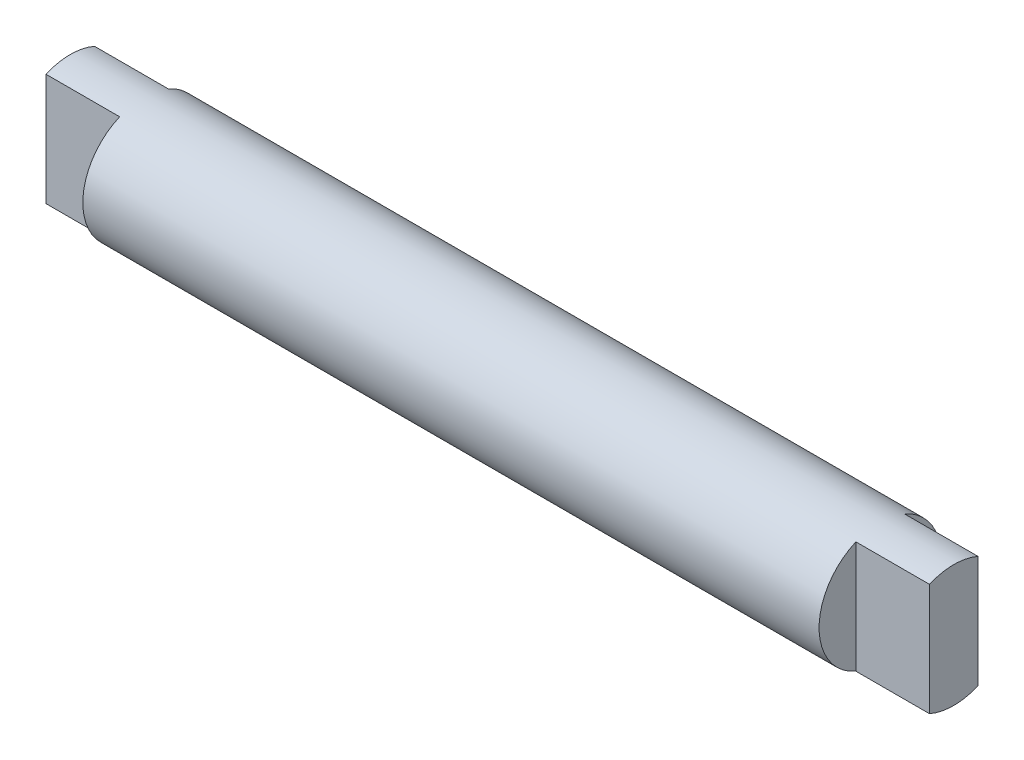
from build123d import *

# Parameters (mm, degrees)
BOSS_EXTRUDE2_DEPTH      = 292.1
BOSS_EXTRUDE2_DEPTH_BACK = 12.7
SKETCH4_R                = 21.063962454
CUT_EXTRUDE2_DEPTH       = 294.615038832
CUT_EXTRUDE2_DEPTH_BACK  = 294.615038832
SKETCH5_W                = 25.4
SKETCH5_H                = 12.7


with BuildPart() as part:
    # Sketch4 → Boss-Extrude2 (new, two sides: drawn at the far end of the back side and taken through both)
    with BuildSketch(Plane(origin=(0, 0, 0), x_dir=(0, 0, -1), z_dir=(1, 0, 0)).offset(-BOSS_EXTRUDE2_DEPTH_BACK)):
        Circle(SKETCH4_R)
    extrude(amount=BOSS_EXTRUDE2_DEPTH + BOSS_EXTRUDE2_DEPTH_BACK)

    # Sketch5 → Cut-Extrude2 (cut, two sides: drawn at the far end of the back side and taken through both)
    with BuildSketch(Plane(origin=(0, 0, 0), x_dir=(1, 0, 0), z_dir=(0, 1, 0)).offset(-CUT_EXTRUDE2_DEPTH_BACK)):
        with Locations((0, -14.713962454)):
            Rectangle(SKETCH5_W, SKETCH5_H)
        with Locations((0, 14.713962454)):
            Rectangle(SKETCH5_W, SKETCH5_H)
        with Locations((279.4, 14.713962454)):
            Rectangle(SKETCH5_W, SKETCH5_H)
        with Locations((279.4, -14.713962454)):
            Rectangle(SKETCH5_W, SKETCH5_H)
    extrude(amount=CUT_EXTRUDE2_DEPTH + CUT_EXTRUDE2_DEPTH_BACK, mode=Mode.SUBTRACT)


solid = part.part
